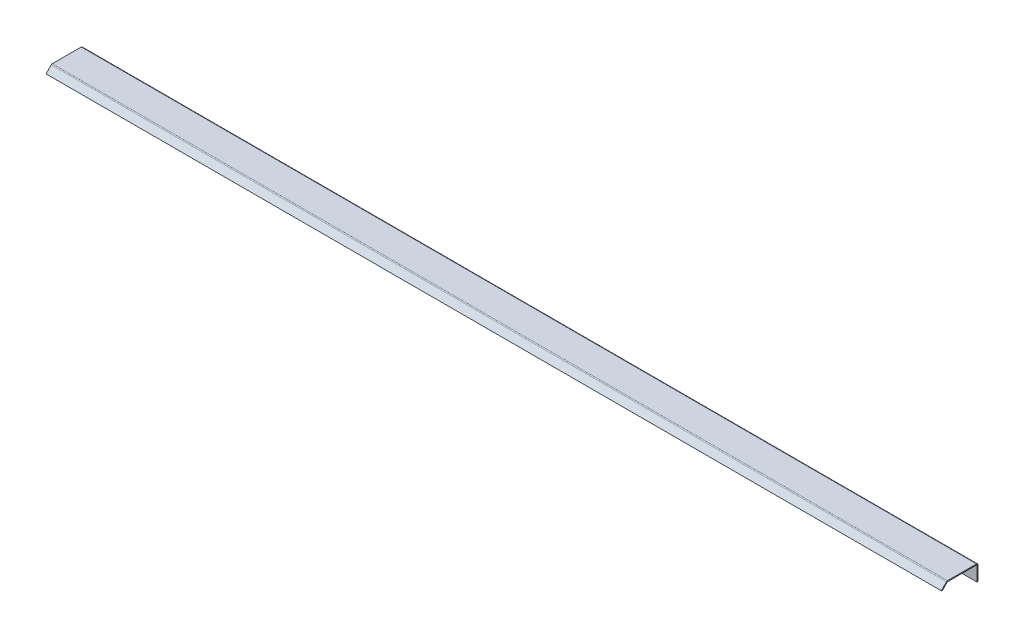
from build123d import *

# Parameters (mm, degrees)
BASE_FLANGE1_DEPTH   = 560
EDGE_FLANGE1_START   = -560
EDGE_FLANGE1_DEPTH   = 1120
EDGE_FLANGE1_2_DEPTH = 1120


# Read off the part's stored shape, not the designer's step: Edge-Flange1
# Sheet-metal steps are written as plain solids
with BuildPart() as part:
    # Sketch1 → Base-Flange1 (new, symmetric)
    with BuildSketch(Plane(origin=(0, 0, 0), x_dir=(0, 0, -1), z_dir=(1, 0, 0))):
        with BuildLine():
            Line((0, -20), (0, -1.9366))
            ThreePointArc((0, -1.9366), (-0.567217008, -0.567217008), (-1.9366, 0))
            Line((-1.9366, 0), (-40, 0))
            Line((-40, 0), (-40, -1.2))
            Line((-40, -1.2), (-1.9366, -1.2))
            ThreePointArc((-1.9366, -1.2), (-1.415745145, -1.415745145), (-1.2, -1.9366))
            Line((-1.2, -1.9366), (-1.2, -20))
            Line((-1.2, -20), (0, -20))
        make_face()
    extrude(amount=BASE_FLANGE1_DEPTH, both=True)

    # Edge-Flange1 outline → Edge-Flange1 (cut)
    with BuildSketch(Plane.YZ.offset(EDGE_FLANGE1_START)):
        with BuildLine():
            Line((-1.2, 40), (-0.567217008, 39.367217008))
            ThreePointArc((-0.567217008, 39.367217008), (-0.147414897, 38.738938751), (0, 37.997834015))
            Line((0, 37.997834015), (0, 40))
            Line((0, 40), (-1.2, 40))
        make_face()
    extrude(amount=EDGE_FLANGE1_DEPTH, mode=Mode.SUBTRACT)

    # Edge-Flange1 2 outline → Edge-Flange1 2 (add)
    with BuildSketch(Plane.YZ.offset(EDGE_FLANGE1_START)):
        with BuildLine():
            Line((-1.2, 37.997834015), (-1.2, 40))
            Line((-1.2, 40), (-7.071067812, 45.871067812))
            Line((-7.071067812, 45.871067812), (-7.919595949, 45.022539674))
            Line((-7.919595949, 45.022539674), (-1.415745145, 38.51868887))
            ThreePointArc((-1.415745145, 38.51868887), (-1.256070336, 38.279718631), (-1.2, 37.997834015))
        make_face()
    extrude(amount=EDGE_FLANGE1_2_DEPTH)


solid = part.part
